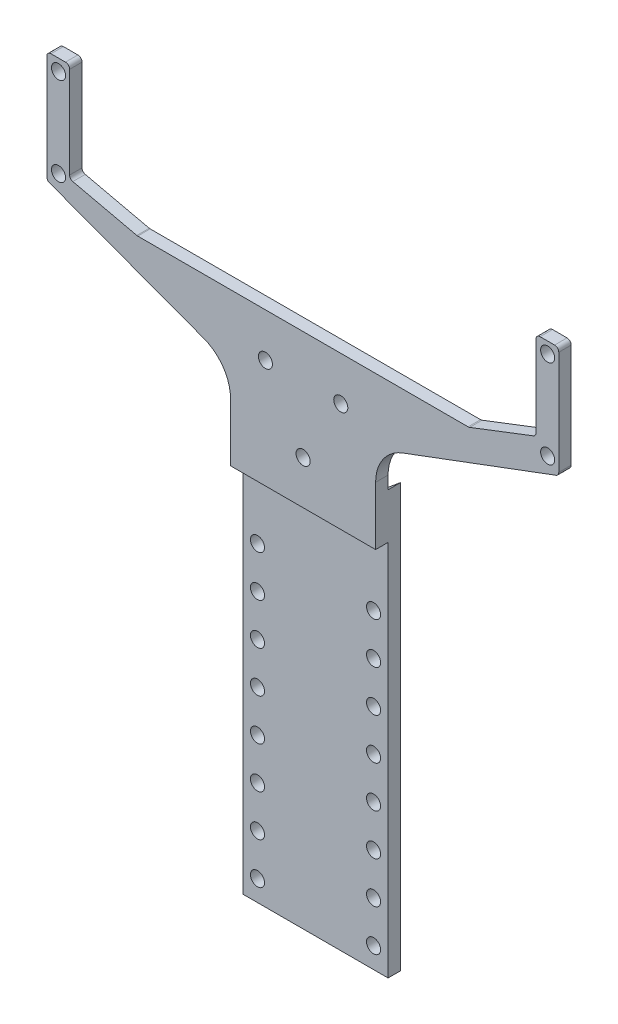
from build123d import *

# Parameters (mm, degrees)
SKETCH2_W                = 90
SKETCH2_H                = 35
SKETCH2_R                = 1.7
BOSS_EXTRUDE1_DEPTH      = 3
SKETCH3_W                = 35
SKETCH3_H                = 2
BOSS_EXTRUDE2_DEPTH      = 8
BOSS_EXTRUDE4_DEPTH      = 1
BOSS_EXTRUDE4_DEPTH_BACK = 5
SKETCH5_W                = 35
SKETCH5_H                = 8
SKETCH6_W                = 35
SKETCH6_H                = 3
BOSS_EXTRUDE5_DEPTH      = 30
FILLET6_R                = 16
SKETCH7_R                = 1.7
CUT_EXTRUDE1_DEPTH       = 5.5
BOSS_EXTRUDE8_DEPTH      = 5.3
BOSS_EXTRUDE8_DEPTH_BACK = 1
SKETCH9_W                = 8
SKETCH9_H                = 3
SKETCH12_R               = 1.7
BOSS_EXTRUDE10_DEPTH     = 3
SKETCH13_W               = 35
SKETCH13_H               = 3
CUT_EXTRUDE2_DEPTH       = 1
SKETCH16_W               = 35
SKETCH16_H               = 3
CUT_EXTRUDE3_DEPTH       = 1
SKETCH17_W               = 23
SKETCH17_H               = 3.7
CUT_EXTRUDE4_DEPTH       = 10
CUT_EXTRUDE5_DEPTH       = 10
SKETCH19_R               = 1.7
BOSS_EXTRUDE14_DEPTH     = 3
FILLET7_R                = 10
FILLET8_R                = 10
BOSS_EXTRUDE15_DEPTH     = 3
FILLET9_R                = 10
FILLET10_R               = 10


with BuildPart() as part:
    # Sketch2 → Boss-Extrude1 (new body)
    with BuildSketch(Plane(origin=(0, 0, 0), x_dir=(0, 1, 0), z_dir=(0, 0, 1))):
        Rectangle(SKETCH2_W, SKETCH2_H)
        with Locations(Location((30, 14, 0), (0, 0, 270))):
            Circle(SKETCH2_R, mode=Mode.SUBTRACT)
        with Locations(Location((30, -14, 0), (0, 0, 270))):
            Circle(SKETCH2_R, mode=Mode.SUBTRACT)
        with Locations(Location((20, -14, 0), (0, 0, 270))):
            Circle(SKETCH2_R, mode=Mode.SUBTRACT)
        with Locations(Location((10, -14, 0), (0, 0, 270))):
            Circle(SKETCH2_R, mode=Mode.SUBTRACT)
        with Locations(Location((0, -14, 0), (0, 0, 270))):
            Circle(SKETCH2_R, mode=Mode.SUBTRACT)
        with Locations(Location((-10, -14, 0), (0, 0, 270))):
            Circle(SKETCH2_R, mode=Mode.SUBTRACT)
        with Locations(Location((-20, -14, 0), (0, 0, 270))):
            Circle(SKETCH2_R, mode=Mode.SUBTRACT)
        with Locations(Location((20, 14, 0), (0, 0, 270))):
            Circle(SKETCH2_R, mode=Mode.SUBTRACT)
        with Locations(Location((10, 14, 0), (0, 0, 270))):
            Circle(SKETCH2_R, mode=Mode.SUBTRACT)
        with Locations(Location((0, 14, 0), (0, 0, 270))):
            Circle(SKETCH2_R, mode=Mode.SUBTRACT)
        with Locations(Location((-10, 14, 0), (0, 0, 270))):
            Circle(SKETCH2_R, mode=Mode.SUBTRACT)
        with Locations(Location((-20, 14, 0), (0, 0, 270))):
            Circle(SKETCH2_R, mode=Mode.SUBTRACT)
        with Locations(Location((-30, -14, 0), (0, 0, 270))):
            Circle(SKETCH2_R, mode=Mode.SUBTRACT)
        with Locations(Location((-30, 14, 0), (0, 0, 270))):
            Circle(SKETCH2_R, mode=Mode.SUBTRACT)
        with Locations(Location((-40, -14, 0), (0, 0, 270))):
            Circle(SKETCH2_R, mode=Mode.SUBTRACT)
        with Locations(Location((-40, 14, 0), (0, 0, 270))):
            Circle(SKETCH2_R, mode=Mode.SUBTRACT)
    extrude(amount=BOSS_EXTRUDE1_DEPTH)

    # Sketch3 → Boss-Extrude2 (add)
    with BuildSketch(Plane(origin=(0, 45, 0), x_dir=(-1, 0, 0), z_dir=(0, 1, 0))):
        with Locations((0, 2)):
            Rectangle(SKETCH3_W, SKETCH3_H)
    extrude(amount=BOSS_EXTRUDE2_DEPTH)

    # Sketch5 → Boss-Extrude4 (add, two sides: drawn at the far end of the back side and taken through both)
    with BuildSketch(Plane(origin=(0, 0, 1), x_dir=(1, 0, 0), z_dir=(0, 0, -1)).offset(-BOSS_EXTRUDE4_DEPTH_BACK)):
        with Locations((0, -49)):
            Rectangle(SKETCH5_W, SKETCH5_H)
    extrude(amount=BOSS_EXTRUDE4_DEPTH + BOSS_EXTRUDE4_DEPTH_BACK)

    # Sketch6 → Boss-Extrude5 (add)
    with BuildSketch(Plane(origin=(0, 53, 0), x_dir=(-1, 0, 0), z_dir=(0, 1, 0))):
        with Locations((0, 4.5)):
            Rectangle(SKETCH6_W, SKETCH6_H)
    extrude(amount=BOSS_EXTRUDE5_DEPTH)

    # Fillet6
    fillet6_edges = [part.edges().sort_by_distance(p)[0] for p in [
        (17.5, 83, 4.5),
        (-17.5, 83, 4.5),
    ]]
    fillet(fillet6_edges, radius=FILLET6_R)

    # Sketch7 → Cut-Extrude1 (cut)
    with BuildSketch(Plane(origin=(0, 0, 3), x_dir=(1, 0, 0), z_dir=(0, 0, -1))):
        with Locations(Location((0, -56.5, 0), (0, 0, 180))):
            Circle(SKETCH7_R)
        with Locations(Location((9.09326674, -72.25, 0), (0, 0, 180))):
            Circle(SKETCH7_R)
        with Locations(Location((-9.09326674, -72.25, 0), (0, 0, 180))):
            Circle(SKETCH7_R)
    extrude(amount=-CUT_EXTRUDE1_DEPTH, mode=Mode.SUBTRACT)

    # Sketch9 → Boss-Extrude8 (add, two sides: drawn at the far end of the back side and taken through both)
    with BuildSketch(Plane(origin=(0, 83, 0), x_dir=(-1, 0, 0), z_dir=(0, 1, 0)).offset(-BOSS_EXTRUDE8_DEPTH_BACK)):
        with Locations((0, 4.5)):
            Rectangle(SKETCH9_W, SKETCH9_H)
    extrude(amount=BOSS_EXTRUDE8_DEPTH + BOSS_EXTRUDE8_DEPTH_BACK)

    # Sketch12 → Boss-Extrude10 (add)
    with BuildSketch(Plane.XY.offset(6)):
        with BuildLine():
            Line((-4, 88.3), (4, 88.3))
            Line((4, 88.3), (34, 88.3))
            Line((34, 88.3), (55.311718973, 89.617849804))
            ThreePointArc((55.311718973, 89.617849804), (55.978601048, 89.931005043), (56.25, 90.615943371))
            Line((56.25, 90.615943371), (56.25, 105.475870157))
            Line((56.25, 105.475870157), (56.25, 109.975870157))
            ThreePointArc((56.25, 109.975870157), (56.542893219, 110.682976939), (57.25, 110.975870157))
            Line((57.25, 110.975870157), (60.75, 110.975870157))
            ThreePointArc((60.75, 110.975870157), (61.457106781, 110.682976939), (61.75, 109.975870157))
            Line((61.75, 109.975870157), (61.75, 105.475870157))
            Line((61.75, 105.475870157), (61.75, 89.675870157))
            Line((61.75, 89.675870157), (61.75, 85.175870157))
            ThreePointArc((61.75, 85.175870157), (61.457106781, 84.468763376), (60.75, 84.175870157))
            Line((60.75, 84.175870157), (56.25, 84.175870157))
            Line((56.25, 84.175870157), (34, 82.803480629))
            Line((34, 82.803480629), (4, 82.803480629))
            Line((4, 82.803480629), (-4, 82.803480629))
            Line((-4, 82.803480629), (-33.969189063, 82.803480629))
            ThreePointArc((-33.969189063, 82.803480629), (-33.999985386, 82.803954949), (-34.030752494, 82.805377456))
            Line((-34.030752494, 82.805377456), (-56.25, 84.175870157))
            Line((-56.25, 84.175870157), (-60.75, 84.175870157))
            ThreePointArc((-60.75, 84.175870157), (-61.457106781, 84.468763376), (-61.75, 85.175870157))
            Line((-61.75, 85.175870157), (-61.75, 89.675870157))
            Line((-61.75, 89.675870157), (-61.75, 105.475870157))
            Line((-61.75, 105.475870157), (-61.75, 109.975870157))
            ThreePointArc((-61.75, 109.975870157), (-61.457106781, 110.682976939), (-60.75, 110.975870157))
            Line((-60.75, 110.975870157), (-57.25, 110.975870157))
            ThreePointArc((-57.25, 110.975870157), (-56.542893219, 110.682976939), (-56.25, 109.975870157))
            Line((-56.25, 109.975870157), (-56.25, 105.475870157))
            Line((-56.25, 105.475870157), (-56.25, 90.615943371))
            ThreePointArc((-56.25, 90.615943371), (-55.978601048, 89.931005043), (-55.311718973, 89.617849804))
            Line((-55.311718973, 89.617849804), (-34, 88.3))
            Line((-34, 88.3), (-4, 88.3))
        make_face()
        with Locations((-59, 86.925870157)):
            Circle(SKETCH12_R, mode=Mode.SUBTRACT)
        with Locations((59, 86.925870157)):
            Circle(SKETCH12_R, mode=Mode.SUBTRACT)
        with Locations((-59, 108.225870157)):
            Circle(SKETCH12_R, mode=Mode.SUBTRACT)
        with Locations((59, 108.225870157)):
            Circle(SKETCH12_R, mode=Mode.SUBTRACT)
    extrude(amount=-BOSS_EXTRUDE10_DEPTH)

    # Sketch13 → Cut-Extrude2 (cut)
    with BuildSketch(Plane.XZ.offset(-45)):
        with Locations((0, 4.5)):
            Rectangle(SKETCH13_W, SKETCH13_H)
    extrude(amount=-CUT_EXTRUDE2_DEPTH, mode=Mode.SUBTRACT)

    # Sketch16 → Cut-Extrude3 (cut)
    with BuildSketch(Plane(origin=(0, 53, 0), x_dir=(-1, 0, 0), z_dir=(0, 1, 0))):
        with Locations((0, 1.5)):
            Rectangle(SKETCH16_W, SKETCH16_H)
    extrude(amount=-CUT_EXTRUDE3_DEPTH, mode=Mode.SUBTRACT)

    # Sketch17 → Cut-Extrude4 (cut)
    with BuildSketch(Plane(origin=(0, 0, 3), x_dir=(1, 0, 0), z_dir=(0, 0, -1))):
        with Locations((-0.016728592, -50.727758944)):
            Rectangle(SKETCH17_W, SKETCH17_H)
    extrude(amount=CUT_EXTRUDE4_DEPTH, mode=Mode.SUBTRACT)

    # Sketch18 → Cut-Extrude5 (cut)
    with BuildSketch(Plane.XY.offset(6)):
        with BuildLine():
            Line((-4, 82.803480629), (-33.969189063, 82.803480629))
            ThreePointArc((-33.969189063, 82.803480629), (-33.999985386, 82.803954949), (-34.030752494, 82.805377456))
            Line((-34.030752494, 82.805377456), (-56.25, 84.175870157))
            Line((-56.25, 84.175870157), (-60.75, 84.175870157))
            ThreePointArc((-60.75, 84.175870157), (-61.457106781, 84.468763376), (-61.75, 85.175870157))
            Line((-61.75, 85.175870157), (-61.75, 109.975870157))
            ThreePointArc((-61.75, 109.975870157), (-61.457106781, 110.682976939), (-60.75, 110.975870157))
            Line((-60.75, 110.975870157), (-57.25, 110.975870157))
            ThreePointArc((-57.25, 110.975870157), (-56.542893219, 110.682976939), (-56.25, 109.975870157))
            Line((-56.25, 109.975870157), (-56.25, 90.615943371))
            ThreePointArc((-56.25, 90.615943371), (-55.978601048, 89.931005043), (-55.311718973, 89.617849804))
            Line((-55.311718973, 89.617849804), (-34, 88.3))
            Line((-34, 88.3), (34, 88.3))
            Line((34, 88.3), (55.311718973, 89.617849804))
            ThreePointArc((55.311718973, 89.617849804), (55.978601048, 89.931005043), (56.25, 90.615943371))
            Line((56.25, 90.615943371), (56.25, 109.975870157))
            ThreePointArc((56.25, 109.975870157), (56.542893219, 110.682976939), (57.25, 110.975870157))
            Line((57.25, 110.975870157), (60.75, 110.975870157))
            ThreePointArc((60.75, 110.975870157), (61.457106781, 110.682976939), (61.75, 109.975870157))
            Line((61.75, 109.975870157), (61.75, 85.175870157))
            ThreePointArc((61.75, 85.175870157), (61.457106781, 84.468763376), (60.75, 84.175870157))
            Line((60.75, 84.175870157), (56.25, 84.175870157))
            Line((56.25, 84.175870157), (34, 82.803480629))
            Line((34, 82.803480629), (4, 82.803480629))
            Line((4, 82.803480629), (-4, 82.803480629))
        make_face()
    extrude(amount=-CUT_EXTRUDE5_DEPTH, mode=Mode.SUBTRACT)

    # Sketch19 → Boss-Extrude14 (add)
    # profile 1 of 3: a face of its own
    with BuildSketch(Plane.XY.offset(6)):
        with BuildLine():
            ThreePointArc((-17.5, 67), (-13.665525061, 77.392304845), (-4, 82.803480629))
            Line((-4, 82.803480629), (-39.887045463, 82.803480629))
            ThreePointArc((-39.887045463, 82.803480629), (-39.999286245, 82.80979959), (-40.110108536, 82.828676615))
            Line((-40.110108536, 82.828676615), (-55.545786191, 86.360801669))
            ThreePointArc((-55.545786191, 86.360801669), (-56.104727937, 86.7123333), (-56.322723119, 87.335605683))
            Line((-56.322723119, 87.335605683), (-56.322723119, 104.926203748))
            Line((-56.322723119, 104.926203748), (-56.322723119, 109.426203748))
            ThreePointArc((-56.322723119, 109.426203748), (-56.615616338, 110.133310529), (-57.322723119, 110.426203748))
            Line((-57.322723119, 110.426203748), (-60.822723119, 110.426203748))
            ThreePointArc((-60.822723119, 110.426203748), (-61.5298299, 110.133310529), (-61.822723119, 109.426203748))
            Line((-61.822723119, 109.426203748), (-61.822723119, 104.81711907))
            Line((-61.822723119, 104.81711907), (-61.822723119, 89.01711907))
            Line((-61.822723119, 89.01711907), (-61.822723119, 84.210710383))
            ThreePointArc((-61.822723119, 84.210710383), (-61.644057187, 83.640262884), (-61.171902421, 83.273654454))
            Line((-61.171902421, 83.273654454), (-17.5, 67))
        make_face()
        with Locations((-59, 86.303480629)):
            Circle(SKETCH19_R, mode=Mode.SUBTRACT)
        with Locations((-59, 107.603480629)):
            Circle(SKETCH19_R, mode=Mode.SUBTRACT)
    # profile 2 of 3: a face of its own
    with BuildSketch(Plane.XY.offset(6)):
        with BuildLine():
            Line((-17.5, 67), (-9.634621245, 74.865378755))
            Line((-9.634621245, 74.865378755), (9.634621245, 74.865378755))
            Line((9.634621245, 74.865378755), (17.5, 67))
            ThreePointArc((17.5, 67), (13.665525061, 77.392304845), (4, 82.803480629))
            Line((4, 82.803480629), (-4, 82.803480629))
            ThreePointArc((-4, 82.803480629), (-13.665525061, 77.392304845), (-17.5, 67))
        make_face()
    # profile 3 of 3: a face of its own
    with BuildSketch(Plane.XY.offset(6)):
        with BuildLine():
            Line((39.814322345, 82.803480629), (4, 82.803480629))
            ThreePointArc((4, 82.803480629), (13.665525061, 77.392304845), (17.5, 67))
            Line((17.5, 67), (61.027652942, 83.283257849))
            ThreePointArc((61.027652942, 83.283257849), (61.498975141, 83.649944179), (61.677276881, 84.219866954))
            Line((61.677276881, 84.219866954), (61.677276881, 89.026275641))
            Line((61.677276881, 89.026275641), (61.677276881, 104.81711907))
            Line((61.677276881, 104.81711907), (61.677276881, 109.31711907))
            ThreePointArc((61.677276881, 109.31711907), (61.384383662, 110.024225851), (60.677276881, 110.31711907))
            Line((60.677276881, 110.31711907), (57.177276881, 110.31711907))
            ThreePointArc((57.177276881, 110.31711907), (56.4701701, 110.024225851), (56.177276881, 109.31711907))
            Line((56.177276881, 109.31711907), (56.177276881, 104.81711907))
            Line((56.177276881, 104.81711907), (56.177276881, 89.712309297))
            ThreePointArc((56.177276881, 89.712309297), (56.001588436, 89.146172865), (55.53625596, 88.778963691))
            Line((55.53625596, 88.778963691), (40.173301424, 82.870135023))
            ThreePointArc((40.173301424, 82.870135023), (39.996879724, 82.820285428), (39.814322345, 82.803480629))
        make_face()
        with Locations((59, 86.303480629)):
            Circle(SKETCH19_R, mode=Mode.SUBTRACT)
        with Locations((59, 107.603480629)):
            Circle(SKETCH19_R, mode=Mode.SUBTRACT)
    extrude(amount=-BOSS_EXTRUDE14_DEPTH)

    # Fillet7
    fillet7_edges = [part.edges().sort_by_distance(p)[0] for p in [
        (-17.5, 67, 4.5),
    ]]
    fillet(fillet7_edges, radius=FILLET7_R)

    # Fillet8
    fillet8_edges = [part.edges().sort_by_distance(p)[0] for p in [
        (17.5, 67, 4.5),
    ]]
    fillet(fillet8_edges, radius=FILLET8_R)

    # Sketch21 → Boss-Extrude15 (add)
    with BuildSketch(Plane(origin=(0, 0, 3), x_dir=(1, 0, 0), z_dir=(0, 0, -1))):
        Polygon((-11.516728592, -52), (-17.5, -52), (-17.5, -57), align=None)
        Polygon((17.5, -57), (17.5, -52), (11.483271408, -52), align=None)
    extrude(amount=BOSS_EXTRUDE15_DEPTH)

    # Fillet9
    # the kernel refuses this fillet: 10 mm, written as the material it adds along each edge
    with BuildSketch(Plane(origin=(-11.516728592, 48.877758944, 3), x_dir=(1, 0, 0), z_dir=(0, 0, -1))) as fillet9_piece_1:
        with BuildLine():
            CenterArc((7.259230807, -10), FILLET9_R, 90, 46.54569152)
            Line((0, -3.122241056), (-0.145184616, -2.984685877))
            ThreePointArc((-0.145184616, -2.984685877), (-0.2, -1.561120528), (-0.2, 0))
            Line((-0.2, 0), (0, 0.2))
            Line((0, 0.2), (7.259230807, 0.2))
            Line((7.259230807, 0.2), (7.259230807, 0))
        make_face()
    extrude(amount=3)

    # Fillet10
    # the kernel refuses this fillet: 10 mm, written as the material it adds along each edge
    with BuildSketch(Plane(origin=(11.483271408, 48.877758944, 3), x_dir=(-1, 0, 0), z_dir=(0, 0, -1))) as fillet10_piece_1:
        with BuildLine():
            CenterArc((7.259230807, 10), FILLET10_R, 223.45430848, 46.54569152)
            Line((0, 3.122241056), (-0.145184616, 2.984685877))
            ThreePointArc((-0.145184616, 2.984685877), (-0.2, 1.561120528), (-0.2, 0))
            Line((-0.2, 0), (0, -0.2))
            Line((0, -0.2), (7.259230807, -0.2))
            Line((7.259230807, -0.2), (7.259230807, 0))
        make_face()
    extrude(amount=3)


solid = part.part
